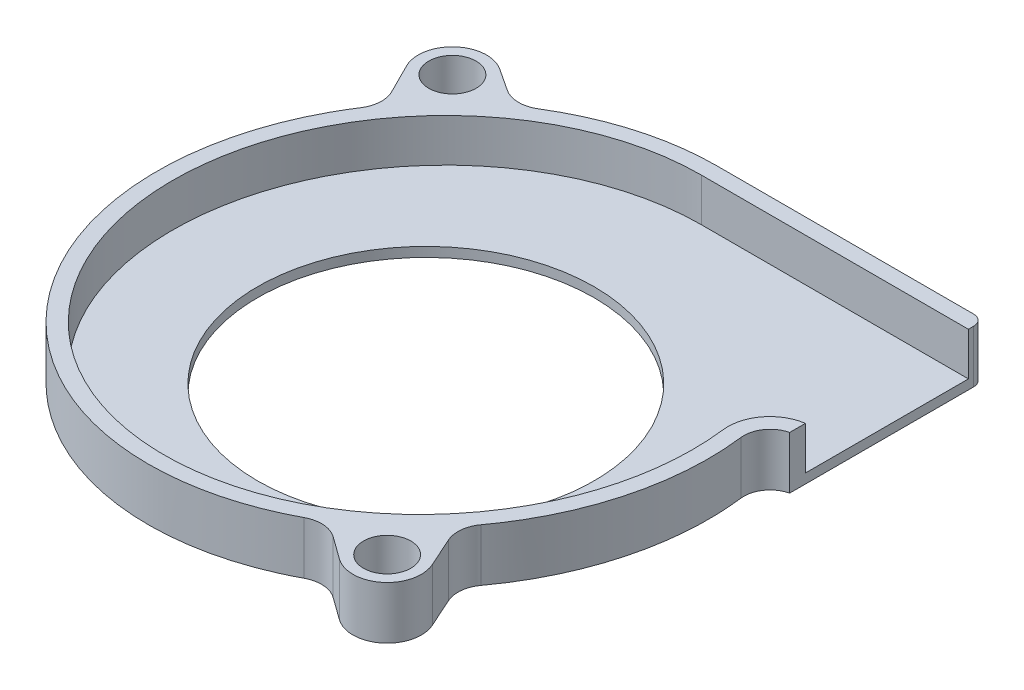
from build123d import *

# Parameters (mm, degrees)
SKETCH18_R          = 2.25
SKETCH18_R_2        = 16
BOSS_EXTRUDE2_DEPTH = 0.91
FILLET1_R           = 2.5
SKETCH22_R          = 2.25
BOSS_EXTRUDE3_DEPTH = 4.09


with BuildPart() as part:
    # Sketch18 → Boss-Extrude2 (new body)
    with BuildSketch(Plane(origin=(0, 0, 0), x_dir=(1, 0, 0), z_dir=(0, 1, 0))):
        with BuildLine():
            Line((-23.005700489, 21.173936517), (-21.582450949, 18.333239239))
            ThreePointArc((-21.582450949, 18.333239239), (-21.290226852, 16.922030245), (-21.738588357, 15.552403394))
            add(Edge.make_bspline(
                [(-21.738588357, 15.552403394), (-74.642199686, -65.790312539), (9.324862756, -20.895925284)],
                knots=[4.619035423, 4.619035423, 4.619035423, 7.234825226, 7.234825226, 7.234825226], degree=2, weights=[1, 0.259883374, 1]))
            ThreePointArc((9.324862756, -20.895925284), (10.831803609, -20.571378647), (12.282148638, -21.093586031))
            Line((12.282148638, -21.093586031), (14.423232763, -22.636631148))
            ThreePointArc((14.423232763, -22.636631148), (18.378398581, -22.5178413), (19.287328639, -18.666699414))
            Line((19.287328639, -18.666699414), (18.031066286, -15.874036932))
            ThreePointArc((18.031066286, -15.874036932), (17.800260945, -14.429576005), (18.329372436, -13.065838675))
            add(Edge.make_bspline(
                [(18.329372436, -13.065838675), (25.853819451, -2.840337036), (23.001584271, 9.2)],
                knots=[1.416240338, 1.416240338, 1.416240338, 2.32192048, 2.32192048, 2.32192048], degree=2, weights=[1, 0.89920814, 1]))
            Line((23.001584271, 9.2), (25.4, 9.2))
            Line((25.4, 9.2), (25.4, 26.7))
            ThreePointArc((25.4, 26.7), (25.107106781, 27.407106781), (24.4, 27.7))
            Line((24.4, 27.7), (-0.010581904, 27.7))
            add(Edge.make_bspline(
                [(-0.010581904, 27.7), (-7.028971285, 27.7), (-13.197915422, 23.907683644)],
                knots=[3.605852843, 3.605852843, 3.605852843, 4.154921422, 4.154921422, 4.154921422], degree=2, weights=[1, 0.962551555, 1]))
            ThreePointArc((-13.197915422, 23.907683644), (-14.708437667, 23.493357847), (-16.205141277, 23.955117118))
            Line((-16.205141277, 23.955117118), (-18.311498324, 25.343379249))
            ThreePointArc((-18.311498324, 25.343379249), (-22.258262373, 25.059651887), (-23.005700489, 21.173936517))
        make_face()
        with Locations(Location((16.3234107, -20, 0), (0, 0, 270))):
            Circle(SKETCH18_R, mode=Mode.SUBTRACT)
        with Locations(Location((-20.1, 22.629754043, 0), (0, 0, 270))):
            Circle(SKETCH18_R, mode=Mode.SUBTRACT)
        with Locations(Location((0, 0, 0), (0, 0, 270))):
            Circle(SKETCH18_R_2, mode=Mode.SUBTRACT)
    extrude(amount=BOSS_EXTRUDE2_DEPTH)

    # Fillet1
    # the kernel refuses this fillet: 2.5 mm, written as the material it adds along each edge
    with BuildSketch(Plane(origin=(23.001584271, 0, -9.2), x_dir=(0.17749566979778525, 0, 0.984121581514721), z_dir=(0, 1, 0))) as fillet1_piece_1:
        with BuildLine():
            CenterArc((2.92200386, 2.496380503), FILLET1_R, 183.119527415, 83.796971124)
            Line((0.425708406, 2.360332681), (0.375782497, 2.357611724))
            ThreePointArc((0.375782497, 2.357611724), (0.163648124, 1.189041124), (-0.049206079, 0.008874783))
            Line((-0.049206079, 0.008874783), (0.002706733, -0.049926682))
            ThreePointArc((0.002706733, -0.049926682), (1.393761766, -0.012367951), (2.7848361, -0.04992761))
            Line((2.7848361, -0.04992761), (2.787525664, 0))
        make_face()
    extrude(amount=0.91)

    # Sketch22 → Boss-Extrude3 (add)
    with BuildSketch(Plane(origin=(0, 0.91, 0), x_dir=(-1, 0, 0), z_dir=(0, -1, 0))):
        with BuildLine():
            Line((0.010581904, 27.7), (-24.4, 27.7))
            ThreePointArc((-24.4, 27.7), (-25.107106781, 27.407106781), (-25.4, 26.7))
            Line((-25.4, 26.7), (-25.4, 26.2))
            Line((-25.4, 26.2), (-0.014228053, 26.2))
            add(Edge.make_bspline(
                [(-22.009855277, 6.248911304), (-30.213360073, -59.767695507), (17.213875049, -16.74891887), (64.641110172, 26.269857768), (-0.014228053, 26.2)],
                knots=[0.928145376, 0.928145376, 0.928145376, 3.374828843, 3.374828843, 5.82151231, 5.82151231, 5.82151231], degree=2, weights=[1, 0.340505614, 1, 0.340505614, 1]))
            ThreePointArc((-22.009855277, 6.248911304), (-22.797198249, 9.165822239), (-25.4, 10.7))
            Line((-25.4, 10.7), (-25.4, 9.2))
            ThreePointArc((-25.4, 9.2), (-23.923052453, 8.192770648), (-23.496358005, 6.456735835))
            add(Edge.make_bspline(
                [(-23.496358005, 6.456735835), (-24.834553394, -4.225489554), (-18.329372436, -13.065838675)],
                knots=[4.07057976, 4.07057976, 4.07057976, 4.866944969, 4.866944969, 4.866944969], degree=2, weights=[1, 0.9217672, 1]))
            ThreePointArc((-18.329372436, -13.065838675), (-17.800260945, -14.429576005), (-18.031066286, -15.874036932))
            Line((-18.031066286, -15.874036932), (-19.287328639, -18.666699414))
            ThreePointArc((-19.287328639, -18.666699414), (-18.378398581, -22.5178413), (-14.423232763, -22.636631148))
            Line((-14.423232763, -22.636631148), (-12.282148638, -21.093586031))
            ThreePointArc((-12.282148638, -21.093586031), (-10.831803609, -20.571378647), (-9.324862756, -20.895925284))
            add(Edge.make_bspline(
                [(-9.324862756, -20.895925284), (74.642199686, -65.790312539), (21.738588357, 15.552403394)],
                knots=[5.331545389, 5.331545389, 5.331545389, 7.947335192, 7.947335192, 7.947335192], degree=2, weights=[1, 0.259883374, 1]))
            ThreePointArc((21.738588357, 15.552403394), (21.290226852, 16.922030245), (21.582450949, 18.333239239))
            Line((21.582450949, 18.333239239), (23.005700489, 21.173936517))
            ThreePointArc((23.005700489, 21.173936517), (22.258262373, 25.059651887), (18.311498324, 25.343379249))
            Line((18.311498324, 25.343379249), (16.205141277, 23.955117118))
            ThreePointArc((16.205141277, 23.955117118), (14.708437667, 23.493357847), (13.197915422, 23.907683644))
            add(Edge.make_bspline(
                [(13.197915422, 23.907683644), (7.028971285, 27.7), (0.010581904, 27.7)],
                knots=[2.128263885, 2.128263885, 2.128263885, 2.677332464, 2.677332464, 2.677332464], degree=2, weights=[1, 0.962551555, 1]))
        make_face()
        with Locations(Location((20.1, 22.629754043, 0), (0, 0, 90))):
            Circle(SKETCH22_R, mode=Mode.SUBTRACT)
        with Locations(Location((-16.3234107, -20, 0), (0, 0, 90))):
            Circle(SKETCH22_R, mode=Mode.SUBTRACT)
    extrude(amount=-BOSS_EXTRUDE3_DEPTH)


solid = part.part
